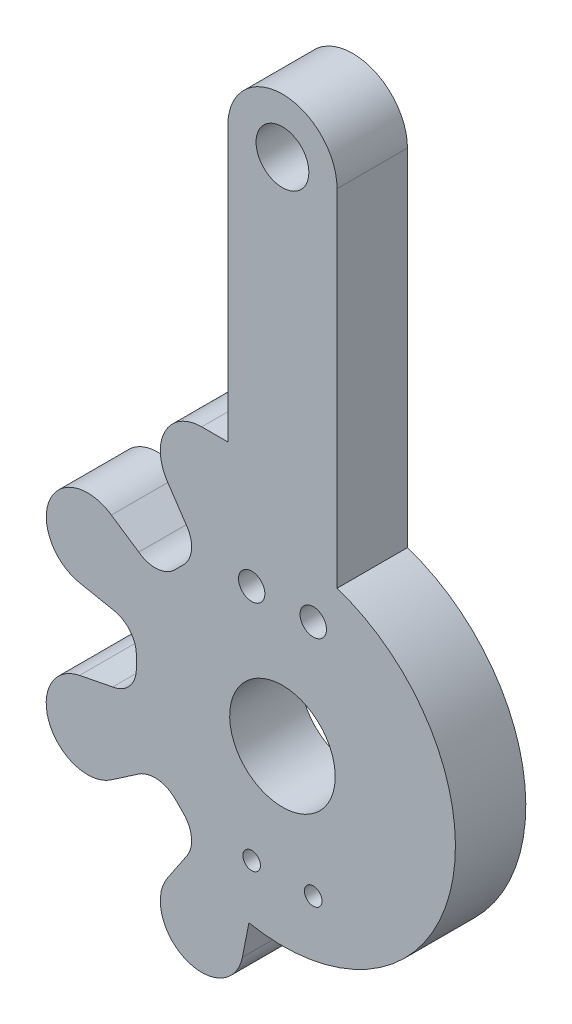
from build123d import *

# Parameters (mm, degrees)
SKETCH1_R           = 0.499999685
SKETCH1_R_2         = 0.499999936
SKETCH1_R_3         = 3.000000209
SKETCH1_R_4         = 0.750000452
SKETCH1_R_5         = 0.748506913
SKETCH1_R_6         = 1.500187581
BOSS_EXTRUDE1_DEPTH = 4


# Read off the part's stored shape, not the designer's step: Imported1
with BuildPart() as part:
    # Sketch1 → Boss-Extrude1 (new body)
    with BuildSketch(Plane(origin=(0, 0, 0), x_dir=(-1, 0, 0), z_dir=(0, 0, -1))):
        with BuildLine():
            ThreePointArc((-10.3249643, 42.429967422), (-13.429964129, 45.534967549), (-16.534963959, 42.429967422))
            Line((-16.534963959, 42.429967422), (-16.534963959, 22.759328173))
            ThreePointArc((-16.534963959, 22.759328173), (-22.936546798, 10.91939696), (-11.523821193, 3.783997304))
            Line((-11.523821193, 3.783997304), (-11.151510993, 1.898050354))
            ThreePointArc((-11.151510993, 1.898050354), (-7.958448418, 0.172164331), (-6.866399752, 3.633632355))
            Line((-6.866399752, 3.633632355), (-6.907151039, 3.694454964))
            Line((-6.907151039, 3.694454964), (-7.95702579, 5.261426867))
            ThreePointArc((-7.95702579, 5.261426867), (-8.261161621, 6.315782715), (-7.802888126, 7.312853556))
            Line((-7.802888126, 7.312853556), (-7.336401059, 7.778170532))
            ThreePointArc((-7.336401059, 7.778170532), (-6.328947455, 8.250313315), (-5.25191043, 7.971256294))
            Line((-5.25191043, 7.971256294), (-3.681946925, 6.898545358))
            ThreePointArc((-3.681946925, 6.898545358), (-0.18308636, 7.931946592), (-1.898741108, 11.151647221))
            Line((-1.898741108, 11.151647221), (-3.784109013, 11.52325713))
            ThreePointArc((-3.784109013, 11.52325713), (-4.744145314, 12.052872295), (-5.125871494, 13.080708395))
            Line((-5.125871494, 13.080708395), (-5.125914366, 13.778599746))
            Line((-5.125914366, 13.778599746), (-5.125914378, 13.778793202))
            ThreePointArc((-5.125914378, 13.778793202), (-4.744155373, 14.806645767), (-3.783994211, 15.336090171))
            Line((-3.783994211, 15.336090171), (-1.90356186, 15.70732102))
            ThreePointArc((-1.90356186, 15.70732102), (-0.193583134, 18.935202355), (-3.703637126, 19.946521356))
            Line((-3.703637126, 19.946521356), (-5.261386695, 18.902842274))
            ThreePointArc((-5.261386695, 18.902842274), (-6.314757765, 18.59870429), (-7.311417899, 19.055605922))
            Line((-7.311417899, 19.055605922), (-7.805450119, 19.549549653))
            ThreePointArc((-7.805450119, 19.549549653), (-8.262234293, 20.54598288), (-7.957754629, 21.598989571))
            Line((-7.957754629, 21.598989571), (-6.908352, 23.163741071))
            Line((-6.908352, 23.163741071), (-6.866399752, 23.226295558))
            ThreePointArc((-6.866399752, 23.226295558), (-6.774111326, 25.630427698), (-8.842129144, 26.859927922))
            Line((-8.842129144, 26.859927922), (-10.3249643, 26.859927922))
            Line((-10.3249643, 26.859927922), (-10.3249643, 42.429967422))
        make_face()
        with Locations(Location((-15.179963978, 6.929964102, 0), (0, 0, 90))):
            Circle(SKETCH1_R, mode=Mode.SUBTRACT)
        with Locations(Location((-11.679964298, 6.929964382, 0), (0, 0, 90))):
            Circle(SKETCH1_R_2, mode=Mode.SUBTRACT)
        with Locations(Location((-13.42996461, 13.429962781, 0), (0, 0, 90))):
            Circle(SKETCH1_R_3, mode=Mode.SUBTRACT)
        with Locations(Location((-15.179964076, 20.429963954, 0), (0, 0, 90))):
            Circle(SKETCH1_R_4, mode=Mode.SUBTRACT)
        with Locations(Location((-11.681540167, 20.429629577, 0), (0, 0, 90))):
            Circle(SKETCH1_R_5, mode=Mode.SUBTRACT)
        with Locations(Location((-13.429420254, 42.425723706, 0), (0, 0, 90))):
            Circle(SKETCH1_R_6, mode=Mode.SUBTRACT)
    extrude(amount=BOSS_EXTRUDE1_DEPTH)


solid = part.part
